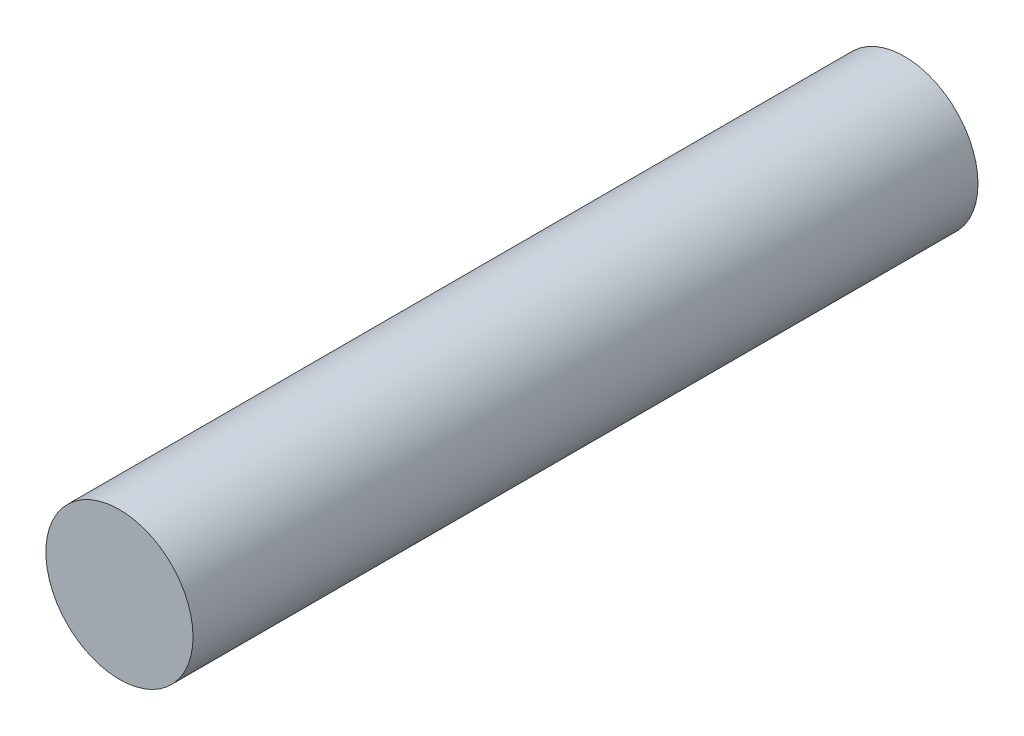
from build123d import *

# Parameters (mm, degrees)
SKETCH1_R           = 37.5
BOSS_EXTRUDE1_DEPTH = 400


with BuildPart() as part:
    # Sketch1 → Boss-Extrude1 (new body)
    with BuildSketch(Plane.XY):
        Circle(SKETCH1_R)
    extrude(amount=BOSS_EXTRUDE1_DEPTH)


solid = part.part
